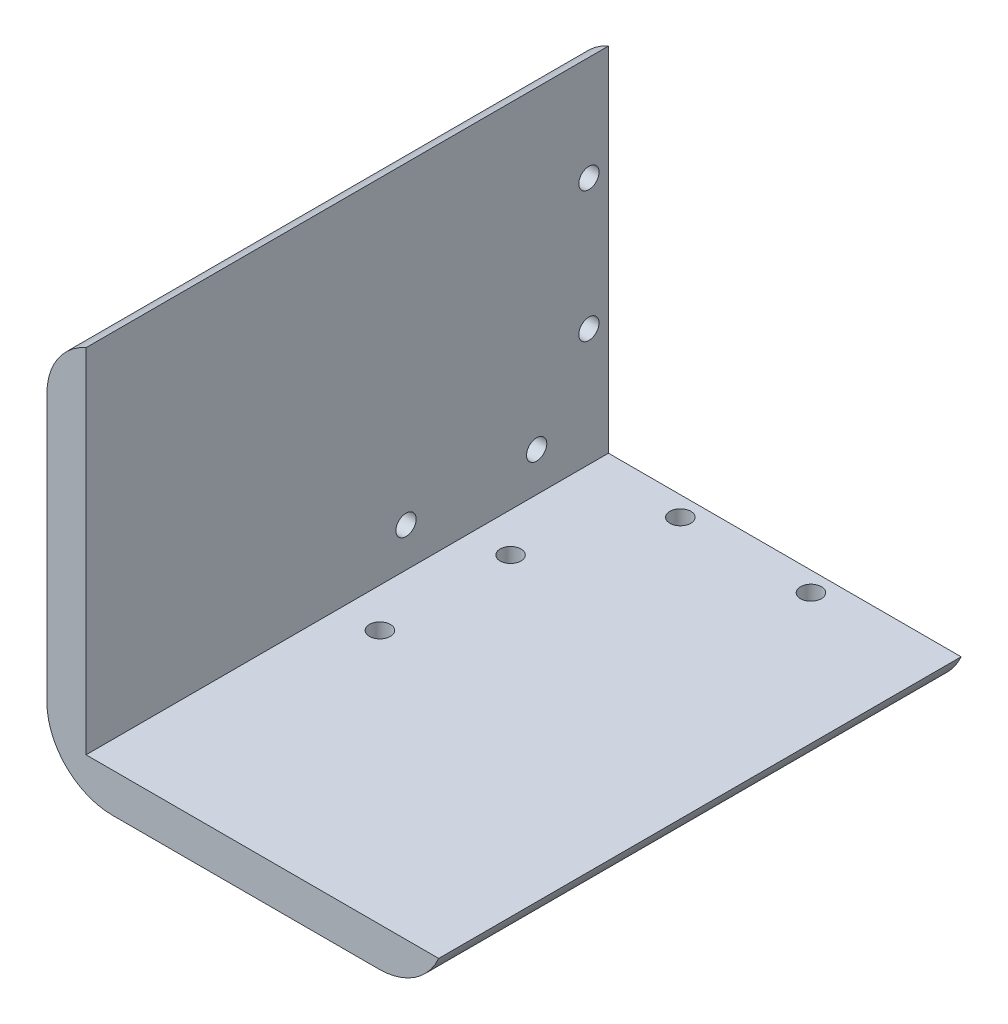
from build123d import *

# Parameters (mm, degrees)
EXTRUDE_1_DEPTH     = 40
FILLET_1_R          = 10
SKETCH_3_R          = 1.55
CUT_EXTRUDE_1_DEPTH = 94.808315196
SKETCH_4_R          = 1.6
CUT_EXTRUDE_2_DEPTH = 91.088845036
SKETCH_5_R          = 1.6
CUT_EXTRUDE_3_DEPTH = 94.808315196


with BuildPart() as part:
    # 草图1 → 凸台-拉伸1 (new, symmetric)
    with BuildSketch(Plane.XY):
        Polygon((0, 0), (0, 60), (6, 60), (6, 6), (60, 6), (60, 0), align=None)
    extrude(amount=EXTRUDE_1_DEPTH, both=True)

    # 圆角1
    # the kernel refuses this fillet: 10 mm, written as the material it takes off along each edge
    with BuildSketch(Plane(origin=(0, 60, 62.912878475), x_dir=(0, -1, 0), z_dir=(0, 0, -1))) as fillet_1_piece_1:
        with BuildLine():
            CenterArc((9.16515139, -10), FILLET_1_R, 90, 66.421821522)
            Line((0, -6), (-0.183303028, -5.92))
            ThreePointArc((-0.183303028, -5.92), (-0.2, -3), (-0.2, 0))
            Line((-0.2, 0), (0, 0.2))
            Line((0, 0.2), (9.16515139, 0.2))
            Line((9.16515139, 0.2), (9.16515139, 0))
        make_face()
    extrude(amount=125.82575695, mode=Mode.SUBTRACT)
    with BuildSketch(Plane(origin=(60, 0, -62.912878475), x_dir=(0, 1, 0), z_dir=(0, 0, 1))) as fillet_1_piece_2:
        with BuildLine():
            CenterArc((10, 9.16515139), FILLET_1_R, 180, 66.421821522)
            Line((0, 9.16515139), (-0.2, 9.16515139))
            Line((-0.2, 9.16515139), (-0.2, 0))
            Line((-0.2, 0), (0, -0.2))
            ThreePointArc((0, -0.2), (3, -0.2), (5.92, -0.183303028))
            Line((5.92, -0.183303028), (6, 0))
        make_face()
    extrude(amount=125.82575695, mode=Mode.SUBTRACT)
    with BuildSketch(Plane(origin=(0, 0, -65), x_dir=(0, 1, 0), z_dir=(0, 0, 1))) as fillet_1_piece_3:
        with BuildLine():
            CenterArc((FILLET_1_R, -FILLET_1_R), FILLET_1_R, 90, 90)
            Line((0, -FILLET_1_R), (-FILLET_1_R * 0.02, -FILLET_1_R))
            Line((-FILLET_1_R * 0.02, -FILLET_1_R), (-FILLET_1_R * 0.02, FILLET_1_R * 0.02))
            Line((-FILLET_1_R * 0.02, FILLET_1_R * 0.02), (FILLET_1_R, FILLET_1_R * 0.02))
            Line((FILLET_1_R, FILLET_1_R * 0.02), (FILLET_1_R, 0))
        make_face()
    extrude(amount=130, mode=Mode.SUBTRACT)

    # 草图3 → 切除-拉伸1 (cut, through all)
    with BuildSketch(Plane.ZY):
        with Locations((-37, 44)):
            Circle(SKETCH_3_R)
        with Locations((-37, 24)):
            Circle(SKETCH_3_R)
        with Locations((-29, 12)):
            Circle(SKETCH_3_R)
        with Locations((-9, 12)):
            Circle(SKETCH_3_R)
    extrude(amount=-CUT_EXTRUDE_1_DEPTH, mode=Mode.SUBTRACT)

    # 草图4 → 切除-拉伸2 (cut, through all)
    with BuildSketch(Plane(origin=(0, 6, 0), x_dir=(1, 0, 0), z_dir=(0, 1, 0))):
        with Locations(Location((12, -1, 0), (0, 0, 270))):
            Circle(SKETCH_4_R)
        with Locations(Location((12, 19, 0), (0, 0, 270))):
            Circle(SKETCH_4_R)
    extrude(amount=-CUT_EXTRUDE_2_DEPTH, mode=Mode.SUBTRACT)

    # 草图5 → 切除-拉伸3 (cut, through all)
    with BuildSketch(Plane.XZ):
        with Locations((20, -37)):
            Circle(SKETCH_5_R)
        with Locations((40, -37)):
            Circle(SKETCH_5_R)
    extrude(amount=-CUT_EXTRUDE_3_DEPTH, mode=Mode.SUBTRACT)


solid = part.part
